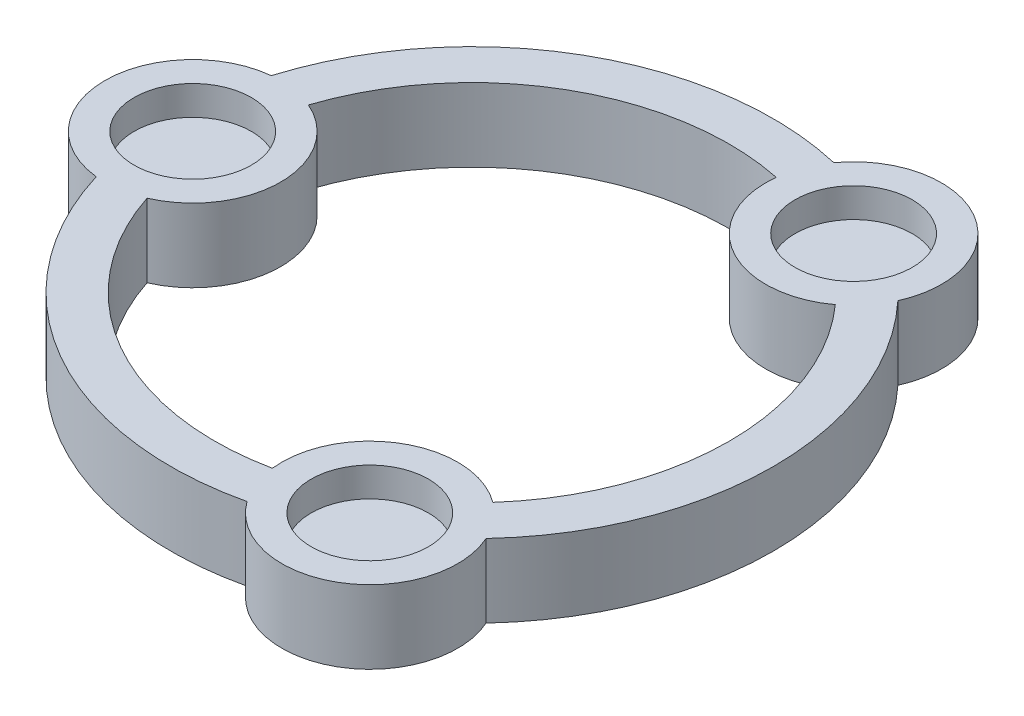
from build123d import *

# Parameters (mm, degrees)
SKETCH2_R           = 26
BOSS_EXTRUDE2_DEPTH = 5
SKETCH3_R           = 4
CUT_EXTRUDE1_DEPTH  = 2
SKETCH5_R           = 26
CUT_EXTRUDE3_DEPTH  = 38.107950631


with BuildPart() as part:
    # Sketch2 → Boss-Extrude2 (new body)
    with BuildSketch(Plane(origin=(0, 0, 0), x_dir=(1, 0, 0), z_dir=(0, 1, 0))):
        Circle(SKETCH2_R)
    extrude(amount=BOSS_EXTRUDE2_DEPTH)

    # Sketch3 → Cut-Extrude1 (cut)
    with BuildSketch(Plane.XZ.offset(-5)):
        with Locations((9.52625, -16.499949006)):
            Circle(SKETCH3_R)
        with Locations((9.52625, 16.499949006)):
            Circle(SKETCH3_R)
        with Locations((-19.0525, 0)):
            Circle(SKETCH3_R)
    extrude(amount=CUT_EXTRUDE1_DEPTH, mode=Mode.SUBTRACT)

    # Sketch5 → Cut-Extrude3 (cut, through all)
    # profile 1 of 2: a face of its own
    with BuildSketch(Plane(origin=(0, 5, 0), x_dir=(1, 0, 0), z_dir=(0, 1, 0))):
        Circle(SKETCH5_R)
        with BuildLine():
            ThreePointArc((-19.664092803, 5.96874813), (-10.275, 17.796822048), (4.662958892, 20.013977975))
            ThreePointArc((4.662958892, 20.013977975), (12.52625, 21.696101428), (15.001133911, 14.045229844))
            ThreePointArc((15.001133911, 14.045229844), (20.55, 0), (15.001133911, -14.045229844))
            ThreePointArc((15.001133911, -14.045229844), (12.52625, -21.696101428), (4.662958892, -20.013977975))
            ThreePointArc((4.662958892, -20.013977975), (-10.275, -17.796822048), (-19.664092803, -5.96874813))
            ThreePointArc((-19.664092803, -5.96874813), (-25.0525, 0), (-19.664092803, 5.96874813))
        make_face(mode=Mode.SUBTRACT)
    # profile 2 of 2: a face of its own
    with BuildSketch(Plane(origin=(0, 5, 0), x_dir=(1, 0, 0), z_dir=(0, 1, 0))):
        with BuildLine():
            ThreePointArc((13.099112583, 11.679715302), (6.52625, 11.303796583), (3.565373869, 17.184021915))
            ThreePointArc((3.565373869, 17.184021915), (-8.775, 15.198745836), (-16.664486452, 5.504306613))
            ThreePointArc((-16.664486452, 5.504306613), (-13.0525, 0), (-16.664486452, -5.504306613))
            ThreePointArc((-16.664486452, -5.504306613), (-8.775, -15.198745836), (3.565373869, -17.184021915))
            ThreePointArc((3.565373869, -17.184021915), (6.52625, -11.303796583), (13.099112583, -11.679715302))
            ThreePointArc((13.099112583, -11.679715302), (17.55, 0), (13.099112583, 11.679715302))
        make_face()
    extrude(amount=-CUT_EXTRUDE3_DEPTH, mode=Mode.SUBTRACT)


solid = part.part
